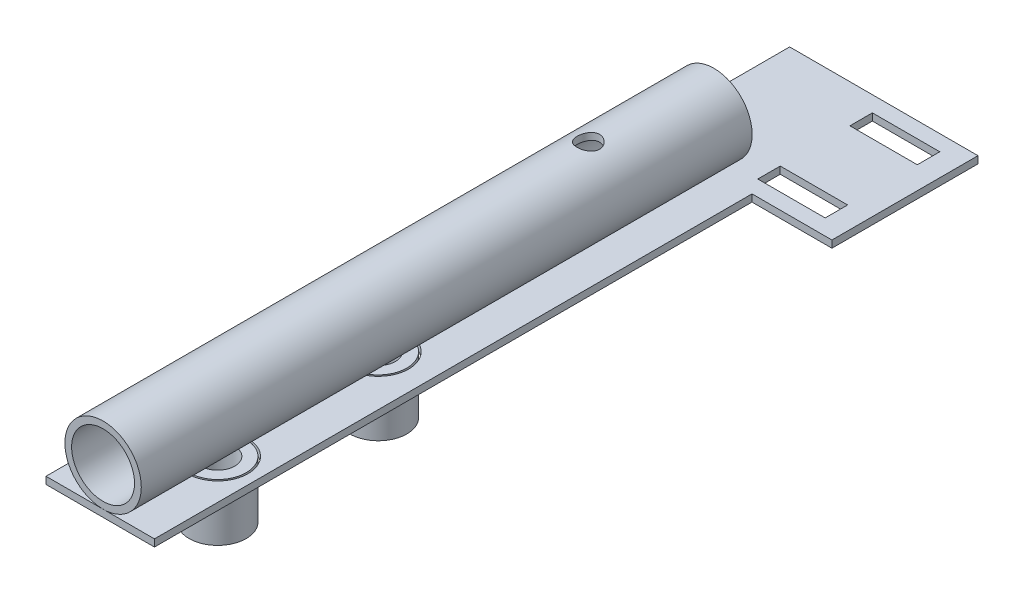
from build123d import *

# Parameters (mm, degrees)
SKETCH1_R                  = 5
BASE_FLANGE1_DEPTH         = 3.175
BOSS_EXTRUDE2_DEPTH        = 215.9
BOSS_EXTRUDE2_DEPTH_BACK   = 55.92
SKETCH7_R                  = 17
SKETCH7_R_2                = 14
CUT_EXTRUDE1_DEPTH         = 227.233742841
CUT_EXTRUDE1_DEPTH_BACK    = 227.233742841
SKETCH8_R                  = 5
SKETCH9_W                  = 30
SKETCH9_H                  = 10
CUT_EXTRUDE2_DEPTH         = 3.175
SKETCH6_R                  = 13.49375
CUT_EXTRUDE4_DEPTH         = 3.175
BOSS_EXTRUDE3_DEPTH        = 3.175
BOSS_EXTRUDE3_DEPTH_BACK   = 22.225
SKETCH6_5_R                = 12.7
SKETCH6_5_R_2              = 7.62
BOSS_EXTRUDE3_2_DEPTH      = 3.175
BOSS_EXTRUDE3_2_DEPTH_BACK = 22.225


# Sheet-metal steps are written as plain solids
with BuildPart() as part:
    # Sketch1 → Base-Flange1 (new body)
    with BuildSketch(Plane(origin=(0, 0, 0), x_dir=(1, 0, 0), z_dir=(0, 1, 0))):
        Polygon((22.86, -215.9), (-25.4, -215.9), (-25.4, 115), (22.86, 115), (58.42, 115), (58.42, 50), (22.86, 50), align=None)
        with Locations(Location((0, 0, 0), (0, 0, 270))):
            Circle(SKETCH1_R, mode=Mode.SUBTRACT)
    extrude(amount=-BASE_FLANGE1_DEPTH)

    # Sketch9 → Cut-Extrude2 (cut)
    with BuildSketch(Plane.XZ.offset(3.175)):
        with Locations((33.42, -103)):
            Rectangle(SKETCH9_W, SKETCH9_H)
        with Locations((33.42, -62)):
            Rectangle(SKETCH9_W, SKETCH9_H)
    extrude(amount=-CUT_EXTRUDE2_DEPTH, mode=Mode.SUBTRACT)

    # Sketch6 → Cut-Extrude4 (cut)
    with BuildSketch(Plane(origin=(0, -3.175, 0), x_dir=(1, 0, 0), z_dir=(0, 1, 0))):
        with Locations(Location((5.08, -170, 0), (0, 0, 90))):
            Circle(SKETCH6_R)
        with Locations(Location((0.508, -93.937283667, 0), (0, 0, 90))):
            Circle(SKETCH6_R)
    extrude(amount=CUT_EXTRUDE4_DEPTH, mode=Mode.SUBTRACT)


with BuildPart() as body_2:
    # Sketch7 → Boss-Extrude2 (new, two sides: drawn at the far end of the back side and taken through both)
    with BuildSketch(Plane.XY.offset(-BOSS_EXTRUDE2_DEPTH_BACK)):
        with Locations((0, 17)):
            Circle(SKETCH7_R)
        with Locations((0, 17)):
            Circle(SKETCH7_R_2, mode=Mode.SUBTRACT)
    extrude(amount=BOSS_EXTRUDE2_DEPTH + BOSS_EXTRUDE2_DEPTH_BACK)

    # Sketch8 → Cut-Extrude1 (cut, two sides: drawn at the far end of the back side and taken through both)
    with BuildSketch(Plane(origin=(0, 0, 0), x_dir=(1, 0, 0), z_dir=(0, 1, 0)).offset(-CUT_EXTRUDE1_DEPTH_BACK)):
        with Locations(Location((0, 0, 0), (0, 0, 270))):
            Circle(SKETCH8_R)
    extrude(amount=CUT_EXTRUDE1_DEPTH + CUT_EXTRUDE1_DEPTH_BACK, mode=Mode.SUBTRACT)


with BuildPart() as body_3:
    # Sketch6<5> → Boss-Extrude3 (new, two sides: drawn at the far end of the back side and taken through both)
    with BuildSketch(Plane(origin=(0, -3.175, 0), x_dir=(1, 0, 0), z_dir=(0, 1, 0)).offset(-BOSS_EXTRUDE3_DEPTH_BACK)):
        with Locations(Location((5.08, -170, 0), (0, 0, 270))):
            Circle(SKETCH6_5_R)
        with Locations(Location((5.08, -170, 0), (0, 0, 270))):
            Circle(SKETCH6_5_R_2, mode=Mode.SUBTRACT)
    extrude(amount=BOSS_EXTRUDE3_DEPTH + BOSS_EXTRUDE3_DEPTH_BACK)


with BuildPart() as body_4:
    # Sketch6<5> → Boss-Extrude3 2 (new, two sides: drawn at the far end of the back side and taken through both)
    with BuildSketch(Plane(origin=(0, -3.175, 0), x_dir=(1, 0, 0), z_dir=(0, 1, 0)).offset(-BOSS_EXTRUDE3_2_DEPTH_BACK)):
        with Locations(Location((0.508, -93.937283667, 0), (0, 0, 90))):
            Circle(SKETCH6_5_R)
        with Locations(Location((0.508, -93.937283667, 0), (0, 0, 90))):
            Circle(SKETCH6_5_R_2, mode=Mode.SUBTRACT)
    extrude(amount=BOSS_EXTRUDE3_2_DEPTH + BOSS_EXTRUDE3_2_DEPTH_BACK)


solid = Compound([part.part, body_2.part, body_3.part, body_4.part])
